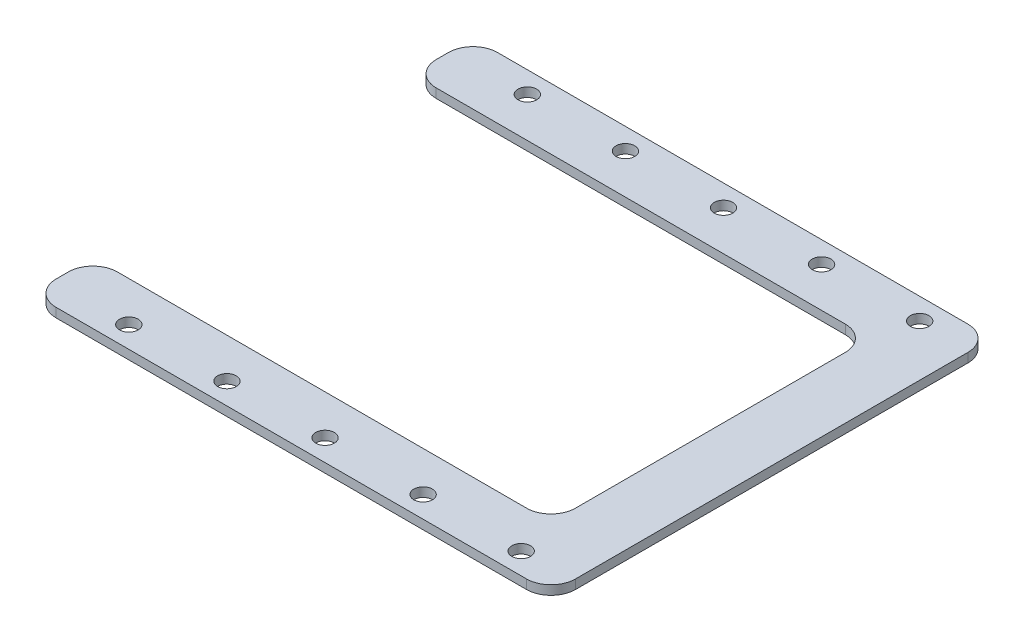
from build123d import *

# Parameters (mm, degrees)
SKETCH1_W          = 153.56078
SKETCH1_H          = 114.3
SKETCH1_R          = 2.413
BASE_FLANGE1_DEPTH = 2.38125
FILLET1_R          = 6.35
SKETCH7_W          = 19.05
SKETCH7_H          = 114.3
CUT_EXTRUDE2_DEPTH = 2.54
FILLET2_R          = 6.35
FILLET3_R          = 6.35


# Sheet-metal steps are written as plain solids
with BuildPart() as part:
    # Sketch1 → Base-Flange1 (new body)
    with BuildSketch(Plane(origin=(0, 0, 0), x_dir=(1, 0, 0), z_dir=(0, 1, 0))):
        Rectangle(SKETCH1_W, SKETCH1_H)
        with Locations(Location((-63.5, -51.59375, 0), (0, 0, 270))):
            Circle(SKETCH1_R, mode=Mode.SUBTRACT)
        with Locations(Location((-38.1, -51.59375, 0), (0, 0, 270))):
            Circle(SKETCH1_R, mode=Mode.SUBTRACT)
        with Locations(Location((-12.7, -51.59375, 0), (0, 0, 270))):
            Circle(SKETCH1_R, mode=Mode.SUBTRACT)
        with Locations(Location((12.7, -51.59375, 0), (0, 0, 270))):
            Circle(SKETCH1_R, mode=Mode.SUBTRACT)
        with Locations(Location((38.1, -51.59375, 0), (0, 0, 270))):
            Circle(SKETCH1_R, mode=Mode.SUBTRACT)
        with Locations(Location((63.5, -51.59375, 0), (0, 0, 270))):
            Circle(SKETCH1_R, mode=Mode.SUBTRACT)
        with Locations(Location((63.5, 51.59375, 0), (0, 0, 270))):
            Circle(SKETCH1_R, mode=Mode.SUBTRACT)
        with Locations(Location((38.1, 51.59375, 0), (0, 0, 270))):
            Circle(SKETCH1_R, mode=Mode.SUBTRACT)
        with Locations(Location((12.7, 51.59375, 0), (0, 0, 270))):
            Circle(SKETCH1_R, mode=Mode.SUBTRACT)
        with Locations(Location((-12.7, 51.59375, 0), (0, 0, 270))):
            Circle(SKETCH1_R, mode=Mode.SUBTRACT)
        with Locations(Location((-38.1, 51.59375, 0), (0, 0, 270))):
            Circle(SKETCH1_R, mode=Mode.SUBTRACT)
        with Locations(Location((-63.5, 51.59375, 0), (0, 0, 270))):
            Circle(SKETCH1_R, mode=Mode.SUBTRACT)
        Polygon((60.90539, -41.275), (-63.104482091, -41.275), (-63.104482091, 41.275), (21.327886111, 41.275), (60.90539, 41.275), (60.90539, 15.875), align=None, mode=Mode.SUBTRACT)
    extrude(amount=-BASE_FLANGE1_DEPTH)

    # Fillet1
    fillet1_edges = [part.edges().sort_by_distance(p)[0] for p in [
        (-76.78039, -1.190625, -57.15),
        (76.78039, -1.190625, -57.15),
        (76.78039, -1.190625, 57.15),
        (-76.78039, -1.190625, 57.15),
    ]]
    fillet(fillet1_edges, radius=FILLET1_R)

    # Sketch7 → Cut-Extrude2 (cut)
    with BuildSketch(Plane(origin=(0, -2.38125, 0), x_dir=(-1, 0, 0), z_dir=(0, -1, 0))):
        with Locations((67.25539, 0)):
            Rectangle(SKETCH7_W, SKETCH7_H)
    extrude(amount=-CUT_EXTRUDE2_DEPTH, mode=Mode.SUBTRACT)

    # Fillet2
    fillet2_edges = [part.edges().sort_by_distance(p)[0] for p in [
        (-57.73039, -1.190625, 41.275),
        (-57.73039, -1.190625, -41.275),
        (-57.73039, -1.190625, 57.15),
        (-57.73039, -1.190625, -57.15),
    ]]
    fillet(fillet2_edges, radius=FILLET2_R)

    # Fillet3
    fillet3_edges = [part.edges().sort_by_distance(p)[0] for p in [
        (60.90539, -1.190625, -41.275),
        (60.90539, -1.190625, 41.275),
    ]]
    fillet(fillet3_edges, radius=FILLET3_R)


solid = part.part
